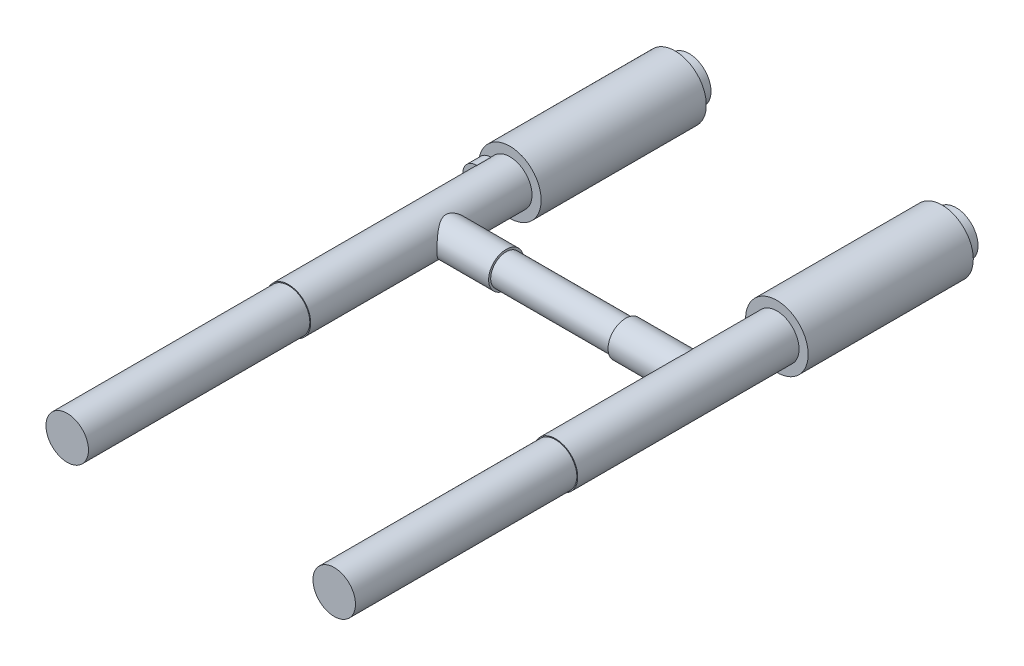
from build123d import *

# Parameters (mm, degrees)
SKETCH1_R           = 7.9375
BOSS_EXTRUDE1_DEPTH = 5.08
SKETCH2_R           = 11.303
BOSS_EXTRUDE2_DEPTH = 59.69
SKETCH3_R           = 8.001
BOSS_EXTRUDE3_DEPTH = 80.01
SKETCH4_R           = 7.6835
BOSS_EXTRUDE4_DEPTH = 80.01
SKETCH6_W           = 5.08
SKETCH6_H           = 12.7
BOSS_EXTRUDE5_DEPTH = 10.01
FILLET1_R           = 5
SKETCH7_R           = 6.35
BOSS_EXTRUDE6_DEPTH = 26.67
SKETCH8_R           = 5.588
BOSS_EXTRUDE7_DEPTH = 21.59


with BuildPart() as part:
    # Sketch1 → Boss-Extrude1 (new body)
    with BuildSketch(Plane.XY):
        Circle(SKETCH1_R)
    boss_extrude1 = extrude(amount=BOSS_EXTRUDE1_DEPTH)

    # Sketch2 → Boss-Extrude2 (add)
    with BuildSketch(Plane.XY.offset(5.08)):
        Circle(SKETCH2_R)
    boss_extrude2 = extrude(amount=BOSS_EXTRUDE2_DEPTH)

    # Sketch3 → Boss-Extrude3 (add)
    with BuildSketch(Plane.XY.offset(64.77)):
        Circle(SKETCH3_R)
    boss_extrude3 = extrude(amount=BOSS_EXTRUDE3_DEPTH)

    # Sketch4 → Boss-Extrude4 (add)
    with BuildSketch(Plane.XY.offset(144.78)):
        Circle(SKETCH4_R)
    boss_extrude4 = extrude(amount=BOSS_EXTRUDE4_DEPTH)

    # Sketch6 → Boss-Extrude5 (add)
    with BuildSketch(Plane(origin=(0, 0, 0), x_dir=(0, 0, -1), z_dir=(1, 0, 0))):
        with Locations((-69.261191794, 0)):
            Rectangle(SKETCH6_W, SKETCH6_H)
    extrude(amount=-BOSS_EXTRUDE5_DEPTH)

    # Fillet1
    fillet1_edges = [part.edges().sort_by_distance(p)[0] for p in [
        (-10.01, -6.35, 69.261191794),
        (-10.01, 6.35, 69.261191794),
    ]]
    fillet(fillet1_edges, radius=FILLET1_R)

    # Sketch7 → Boss-Extrude6 (add)
    with BuildSketch(Plane(origin=(0, 0, 0), x_dir=(0, 0, -1), z_dir=(1, 0, 0))):
        with Locations((-92.78865741, 0)):
            Circle(SKETCH7_R)
    boss_extrude6 = extrude(amount=BOSS_EXTRUDE6_DEPTH)

    # Sketch8 → Boss-Extrude7 (add)
    with BuildSketch(Plane(origin=(26.67, 0, 0), x_dir=(0, 0, -1), z_dir=(1, 0, 0))):
        with Locations((-92.78865741, 0)):
            Circle(SKETCH8_R)
    boss_extrude7 = extrude(amount=BOSS_EXTRUDE7_DEPTH)

    # Mirror2: Boss-Extrude1, Boss-Extrude2, Boss-Extrude3, Boss-Extrude4, Boss-Extrude6, Boss-Extrude7 across plane
    add(boss_extrude1.mirror(Plane(origin=(48.26, 0, 92.78865741), x_dir=(0, 0, 1), z_dir=(1, 0, 0))))
    add(boss_extrude2.mirror(Plane(origin=(48.26, 0, 92.78865741), x_dir=(0, 0, 1), z_dir=(1, 0, 0))))
    add(boss_extrude3.mirror(Plane(origin=(48.26, 0, 92.78865741), x_dir=(0, 0, 1), z_dir=(1, 0, 0))))
    add(boss_extrude4.mirror(Plane(origin=(48.26, 0, 92.78865741), x_dir=(0, 0, 1), z_dir=(1, 0, 0))))
    add(boss_extrude6.mirror(Plane(origin=(48.26, 0, 92.78865741), x_dir=(0, 0, 1), z_dir=(1, 0, 0))))
    add(boss_extrude7.mirror(Plane(origin=(48.26, 0, 92.78865741), x_dir=(0, 0, 1), z_dir=(1, 0, 0))))


solid = part.part
